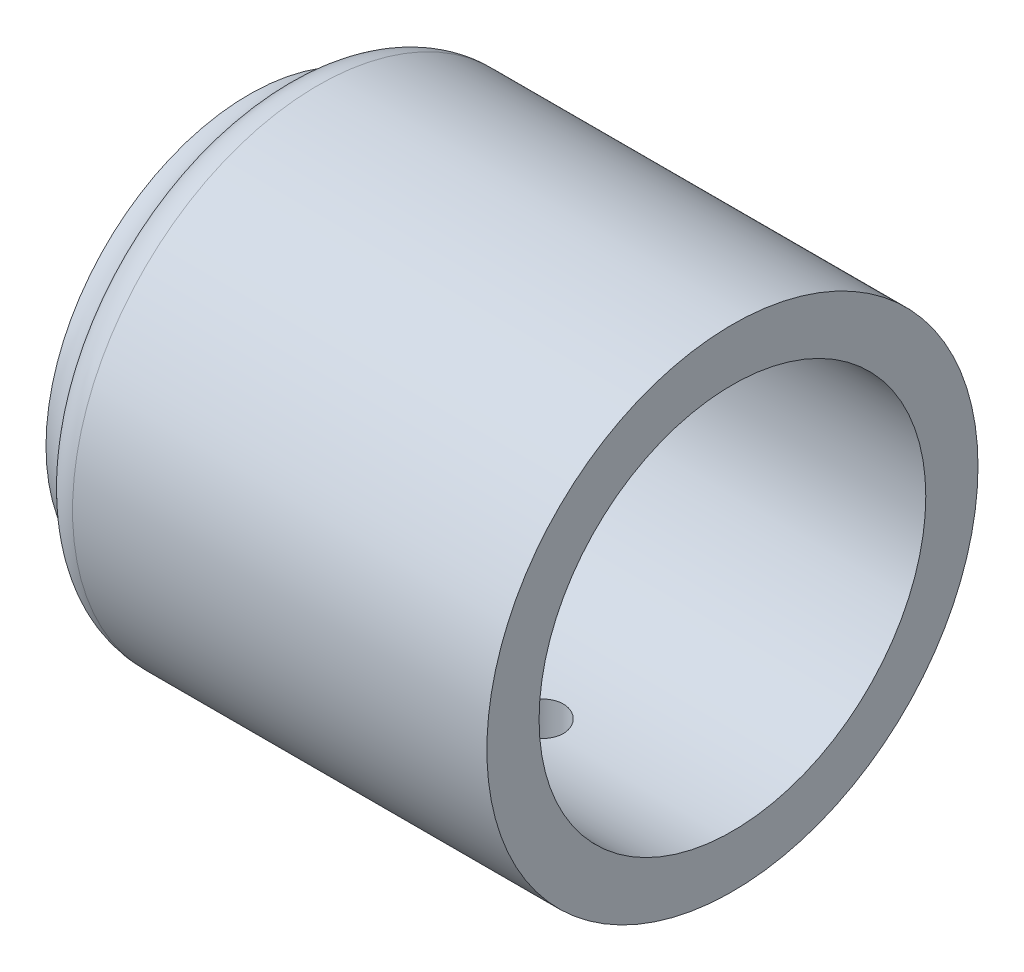
from build123d import *

# Parameters (mm, degrees)
SKETCH1_R                 = 25.4
SKETCH1_R_2               = 20
BOSS_EXTRUDE1_DEPTH       = 50
SKETCH2_R                 = 30
SKETCH2_R_2               = 21
CUT_EXTRUDE1_DEPTH        = 4
FILLET1_R                 = 4
FILLET2_R                 = 4
M6X1_0_TAPPED_HOLE1_D     = 5
M6X1_0_TAPPED_HOLE1_DEPTH = 13.497848452
M6X1_0_TAPPED_HOLE1_TIP   = 1.502151548


# Some blends are built 0.0001 mm under size
with BuildPart() as part:
    # Sketch1 → Boss-Extrude1 (new body)
    with BuildSketch(Plane(origin=(0, 0, 0), x_dir=(0, 0, -1), z_dir=(1, 0, 0))):
        Circle(SKETCH1_R)
        Circle(SKETCH1_R_2, mode=Mode.SUBTRACT)
    extrude(amount=BOSS_EXTRUDE1_DEPTH)

    # Sketch2 → Cut-Extrude1 (cut)
    with BuildSketch(Plane.ZY):
        Circle(SKETCH2_R)
        Circle(SKETCH2_R_2, mode=Mode.SUBTRACT)
    extrude(amount=-CUT_EXTRUDE1_DEPTH, mode=Mode.SUBTRACT)

    # Fillet1
    fillet1_edges = [part.edges().sort_by_distance(p)[0] for p in [
        (4, 0, -21),
    ]]
    fillet(fillet1_edges, radius=FILLET1_R - 0.0001)  # a hair under: the kernel refuses the full size

    # Fillet2
    # the kernel refuses this fillet: 4 mm, written as the material it takes off along each edge
    with BuildSketch(Plane(origin=(4, 0, 0), x_dir=(0, 0, -1), z_dir=(0, 1, 0))) as fillet2_piece_1:
        with BuildLine():
            CenterArc((21.4, -3.144266851), FILLET2_R, 0, 63.256757147)
            Line((25.4, -3.144266851), (25.8, -3.144266851))
            Line((25.8, -3.144266851), (25.8, 0))
            Line((25.8, 0), (25.4, 0.4))
            ThreePointArc((25.4, 0.4), (24.9999, 0.4), (23.37996975, 0.785074034))
            Line((23.37996975, 0.785074034), (23.1999725, 0.427861226))
        make_face()
    revolve(axis=Axis((4, 0, 0), (-1, 0, 0)), mode=Mode.SUBTRACT)

    # M6x1.0 Tapped Hole1
    with Locations(Plane(origin=(0, -25.4, 0), x_dir=(-1, 0, 0), z_dir=(0, -1, 0))):
        with Locations((-30, 0)):
            Hole(M6X1_0_TAPPED_HOLE1_D / 2, depth=M6X1_0_TAPPED_HOLE1_DEPTH)
            with Locations((0, 0, -(M6X1_0_TAPPED_HOLE1_DEPTH + M6X1_0_TAPPED_HOLE1_TIP / 2))):  # 118° drill point
                Cone(0, M6X1_0_TAPPED_HOLE1_D / 2, M6X1_0_TAPPED_HOLE1_TIP, mode=Mode.SUBTRACT)


solid = part.part
